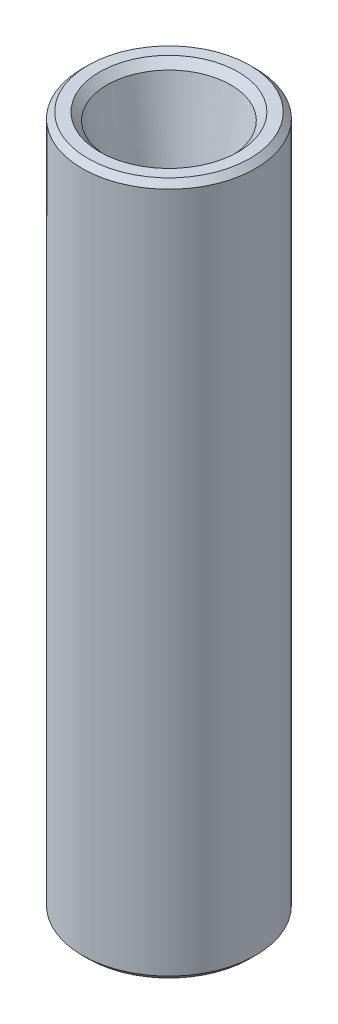
from build123d import *

# Parameters (mm, degrees)
CROQUIS1_R              = 7.5
SALIENTE_EXTRUIR1_DEPTH = 60
CHAFL_N2_SIZE           = 0.5
CHAFL_N2_SIZE_2         = 0.665279689


with BuildPart() as part:
    # Croquis1 → Saliente-Extruir1 (new body)
    with BuildSketch(Plane(origin=(0, 0, 0), x_dir=(1, 0, 0), z_dir=(0, 1, 0))):
        with Locations(Location((0, 0, 0), (0, 0, 270))):
            Circle(CROQUIS1_R)
    extrude(amount=SALIENTE_EXTRUIR1_DEPTH)

    # Cortar-Recubrir2: read off the stored shape, not the designer's step
    # Cortar-Recubrir2: loft between two sections, ruled curve by curve
    cortar_recubrir2_from = [
        Edge.make_bspline([(1.343543407, 40, -2.108291041), (-2.873038675, 40, -4.795377855), (-5.560125489, 40, -0.578795773), (-1.343543407, 40, 2.108291041), (2.873038675, 40, 4.795377855), (5.560125489, 40, 0.578795773), (1.343543407, 40, -2.108291041)], [0, 0, 0, 0, 0.5, 0.5, 0.5, 1, 1, 1, 1], 3, [1, 0.333333333, 0.333333333, 1, 0.333333333, 0.333333333, 1]),
    ]
    cortar_recubrir2_to = [
        Edge.make_bspline([(5.400627652, 60, 1.040779016), (7.482185685, 60, -9.760476288), (-3.319069619, 60, -11.842034321), (-5.400627652, 60, -1.040779016), (-7.482185685, 60, 9.760476288), (3.319069619, 60, 11.842034321), (5.400627652, 60, 1.040779016)], [0, 0, 0, 0, 0.5, 0.5, 0.5, 1, 1, 1, 1], 3, [1, 0.333333333, 0.333333333, 1, 0.333333333, 0.333333333, 1]),
    ]
    cortar_recubrir2 = Solid(Shell([*[Face.make_surface_from_curves(cortar_recubrir2_from[k], cortar_recubrir2_to[k]) for k in range(1)], Face(Wire(cortar_recubrir2_from)), Face(Wire(cortar_recubrir2_to))]))
    add(cortar_recubrir2, mode=Mode.SUBTRACT)

    # Chaflán1
    # the kernel refuses this chamfer: 0.665279689, 0.5 mm, written as the material it takes off along each edge
    with BuildSketch(Plane(origin=(0, 60, 0), x_dir=(0, 0, 1), z_dir=(-1, 0, 0))) as chafl_n1_piece_1:
        with BuildLine():
            Line((7.514142136, -0.514142136), (6.985857864, 0.014142136))
            Line((6.985857864, 0.014142136), (6.985857864, 0.024142136))
            ThreePointArc((6.985857864, 0.024142136), (7.242928932, 0.01), (7.5, 0.01))
            Line((7.5, 0.01), (7.51, 0))
            ThreePointArc((7.51, 0), (7.51, -0.257071068), (7.524142136, -0.514142136))
            Line((7.524142136, -0.514142136), (7.514142136, -0.514142136))
        make_face()
    revolve(axis=Axis((0, 60, 0), (0, 1, 0)), mode=Mode.SUBTRACT)
    with BuildSketch(Plane(origin=(0, 60, 0), x_dir=(0.9819323004404472, 1.2918958832590882e-15, 0.18923254834127032), z_dir=(-0.18923254834127032, 0, 0.9819323004404472))) as chafl_n1_piece_2:
        with BuildLine():
            Line((6.018807954, 0.018825944), (5.333201213, -0.667436596))
            Line((5.333201213, -0.667436596), (5.320226638, -0.664487154))
            ThreePointArc((5.320226638, -0.664487154), (5.410397761, -0.332303159), (5.487030093, 0.002969907))
            Line((5.487030093, 0.002969907), (5.5, 0.013305594))
            ThreePointArc((5.5, 0.013305594), (5.759403977, 0.013305594), (6.018807954, 0.032131538))
            Line((6.018807954, 0.032131538), (6.018807954, 0.018825944))
        make_face()
    revolve(axis=Axis((0, 60, 0), (0, 1, 0)), mode=Mode.SUBTRACT)

    # Simetría7: Cortar-Recubrir2 across plane
    add(cortar_recubrir2.mirror(Plane(origin=(0, 30, 0), x_dir=(0, 0, 1), z_dir=(0, -1, 0))), mode=Mode.SUBTRACT)

    # Chaflán2
    # the kernel refuses this chamfer: 0.665279689, 0.5 mm, written as the material it takes off along each edge
    with BuildSketch(Plane(origin=(0, 0, 0), x_dir=(0, 0, 1), z_dir=(-1, 0, 0))) as chafl_n2_piece_1:
        Polygon((7.5, CHAFL_N2_SIZE), (7.5 - CHAFL_N2_SIZE, 0), (7.5, 0), align=None)
    revolve(axis=Axis((0, 0, 0), (0, 1, 0)), mode=Mode.SUBTRACT)
    with BuildSketch(Plane(origin=(0, 0, 0), x_dir=(0.9819323004404472, 0, 0.18923254834127032), z_dir=(-0.18923254834127032, 0, 0.9819323004404472))) as chafl_n2_piece_2:
        with BuildLine():
            Line((5.5 + CHAFL_N2_SIZE_2, 0), (5.5 - CHAFL_N2_SIZE * 0.22264139859, CHAFL_N2_SIZE * 0.974900409085))
            ThreePointArc((5.5 - CHAFL_N2_SIZE * 0.22264139859, CHAFL_N2_SIZE * 0.974900409085), (5.442174309, 0.252877674), (5.5, 0))
            Line((5.5, 0), (5.5 + CHAFL_N2_SIZE_2, 0))
        make_face()
    revolve(axis=Axis((0, 0, 0), (0, 1, 0)), mode=Mode.SUBTRACT)


solid = part.part
